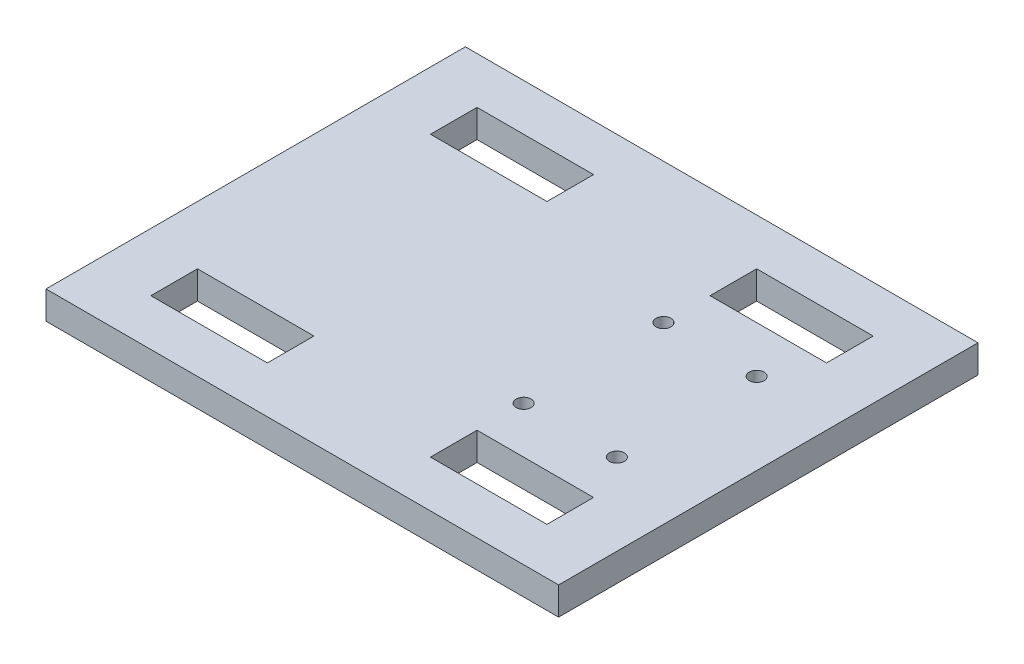
from build123d import *

# Parameters (mm, degrees)
SKETCH1_W               = 110
SKETCH1_H               = 90
BOSS_EXTRUDE1_DEPTH     = 6
SKETCH2_W               = 25
SKETCH2_H               = 10
CUT_EXTRUDE1_DEPTH      = 72.316197319
MIRROR2_COPY_1_SKETCH_W = 25
MIRROR2_COPY_1_SKETCH_H = 10
MIRROR2_COPY_1_DEPTH    = 72.316197319
M3_CLEARANCE_HOLE1_D    = 3.2


with BuildPart() as part:
    # Sketch1 → Boss-Extrude1 (new body)
    with BuildSketch(Plane(origin=(0, 0, 0), x_dir=(1, 0, 0), z_dir=(0, 1, 0))):
        Rectangle(SKETCH1_W, SKETCH1_H)
    extrude(amount=BOSS_EXTRUDE1_DEPTH)

    # Sketch2 → Cut-Extrude1 (cut, through all)
    with BuildSketch(Plane(origin=(0, 6, 0), x_dir=(1, 0, 0), z_dir=(0, 1, 0))):
        with Locations((30, 30)):
            Rectangle(SKETCH2_W, SKETCH2_H)
    cut_extrude1 = extrude(amount=-CUT_EXTRUDE1_DEPTH, mode=Mode.SUBTRACT)

    # Mirror1: Cut-Extrude1 across plane
    add(cut_extrude1.mirror(Plane.XY), mode=Mode.SUBTRACT)

    # Mirror2: Cut-Extrude1 across plane
    add(cut_extrude1.mirror(Plane(origin=(0, 0, 0), x_dir=(0, 0, 1), z_dir=(1, 0, 0))), mode=Mode.SUBTRACT)

    # Mirror2 copy 1 sketch → Mirror2 copy 1 (cut, through all)
    with BuildSketch(Plane(origin=(0, 6, 0), x_dir=(-1, 0, 0), z_dir=(0, 1, 0))):
        with Locations((30, 30)):
            Rectangle(MIRROR2_COPY_1_SKETCH_W, MIRROR2_COPY_1_SKETCH_H)
    extrude(amount=-MIRROR2_COPY_1_DEPTH, mode=Mode.SUBTRACT)

    # M3 Clearance Hole1 (through all)
    with Locations(Plane(origin=(0, 6, 0), x_dir=(1, 0, 0), z_dir=(0, 1, 0))):
        with Locations((17.5, 15), (37.5, 15), (17.5, -15), (37.5, -15)):
            Hole(M3_CLEARANCE_HOLE1_D / 2)


solid = part.part
